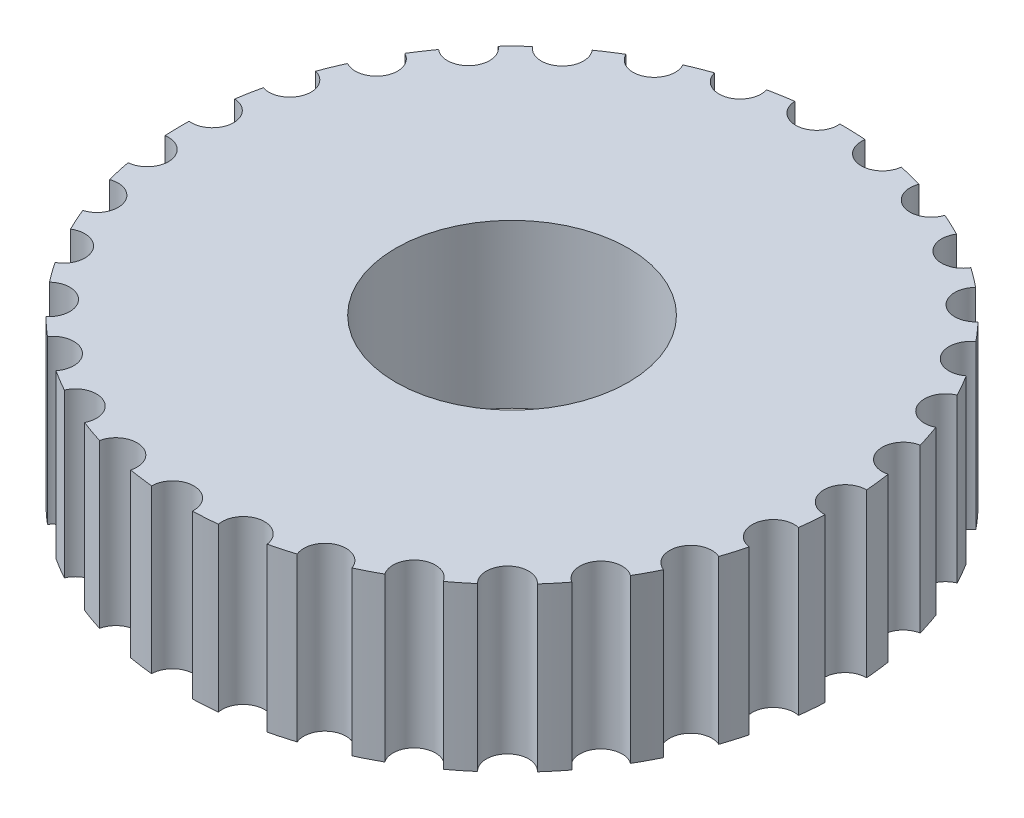
from build123d import *

# Parameters (mm, degrees)
SKETCH1_R             = 20.25
BOSS_EXTRUDE1_DEPTH   = 10
CUT_EXTRUDE2_DEPTH    = 31.33356227
CIRPATTERN2_COUNT     = 31
CIRPATTERN2_ANGLE     = 348.105542821
F_1_0MM_DOWEL_HOLE1_D = 14.2875


with BuildPart() as part:
    # Sketch1 → Boss-Extrude1 (new body)
    with BuildSketch(Plane(origin=(0, 0, 0), x_dir=(1, 0, 0), z_dir=(0, 1, 0))):
        Circle(SKETCH1_R)
    extrude(amount=BOSS_EXTRUDE1_DEPTH)

    # Sketch3 → Cut-Extrude2 (cut, through all)
    with BuildSketch(Plane(origin=(0, 10, 0), x_dir=(1, 0, 0), z_dir=(0, 1, 0))):
        with BuildLine():
            ThreePointArc((4.07303464, 19.836151059), (2.791784158, 20.056832819), (1.49897084, 20.194444444))
            ThreePointArc((1.49897084, 20.194444444), (2.601519457, 18.689926538), (4.07303464, 19.836151059))
        make_face()
    cut_extrude2 = extrude(amount=-CUT_EXTRUDE2_DEPTH, mode=Mode.SUBTRACT)

    # CirPattern2: Cut-Extrude2 ×31 about axis
    cirpattern2_axis = Axis((0, 10, 0), (0, -1, 0))
    for i in range(1, CIRPATTERN2_COUNT):
        add(cut_extrude2.rotate(cirpattern2_axis, i * CIRPATTERN2_ANGLE / (CIRPATTERN2_COUNT - 1)), mode=Mode.SUBTRACT)

    # Ø1.0mm Dowel Hole1 (through all)
    with Locations(Plane(origin=(0, 10, 0), x_dir=(1, 0, 0), z_dir=(0, 1, 0))):
        with Locations((0, 0)):
            Hole(F_1_0MM_DOWEL_HOLE1_D / 2)


solid = part.part
